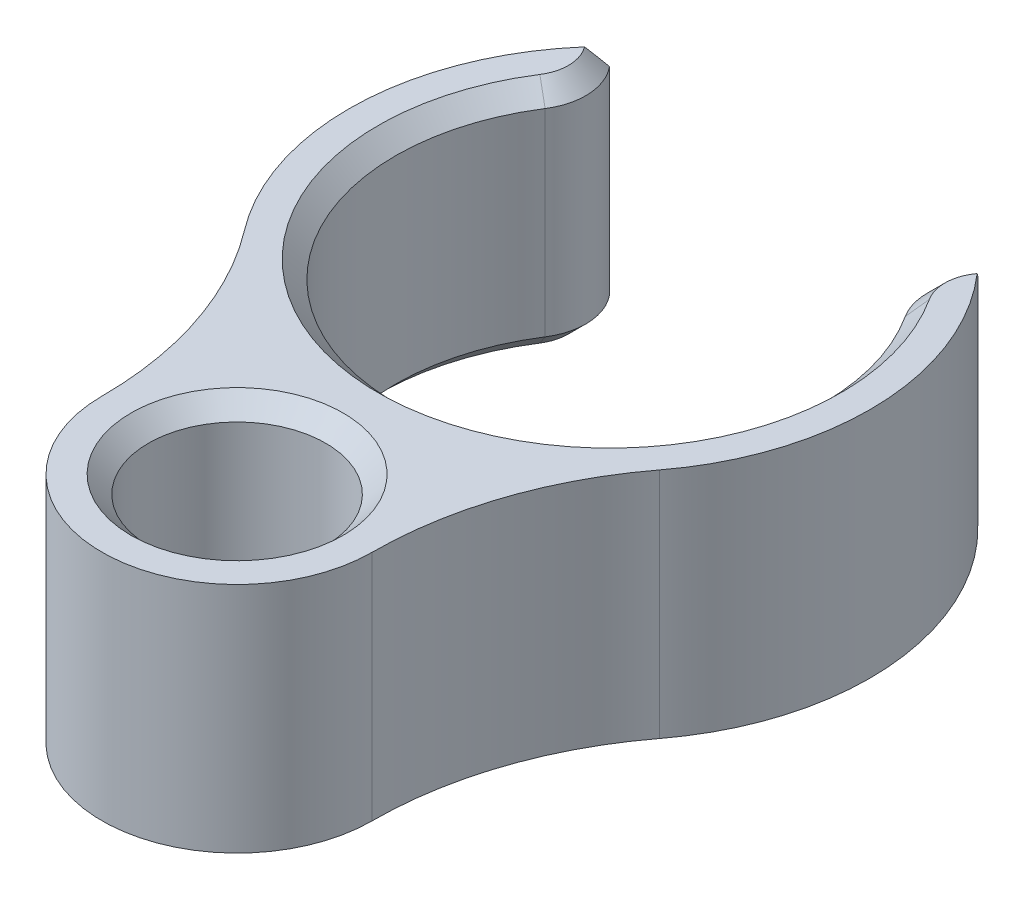
from build123d import *

# Parameters (mm, degrees)
SKETCH1_R           = 3.81
BOSS_EXTRUDE1_DEPTH = 10
CHAMFER1_SIZE       = 0.75
FILLET1_R           = 2.5
CHAMFER2_SIZE       = 0.75


with BuildPart() as part:
    # Sketch1 → Boss-Extrude1 (new body)
    # profile 1 of 2: a face of its own
    with BuildSketch(Plane(origin=(0, 0, 0), x_dir=(1, 0, 0), z_dir=(0, 1, 0))):
        with BuildLine():
            Line((-6.505382387, 22.515382387), (-7.919595949, 23.929595949))
            ThreePointArc((-7.919595949, 23.929595949), (0, 4.81), (7.919595949, 23.929595949))
            Line((7.919595949, 23.929595949), (6.505382387, 22.515382387))
            ThreePointArc((6.505382387, 22.515382387), (0, 6.81), (-6.505382387, 22.515382387))
        make_face()
    # profile 2 of 2: a face of its own
    with BuildSketch(Plane(origin=(0, 0, 0), x_dir=(1, 0, 0), z_dir=(0, 1, 0))):
        with BuildLine():
            ThreePointArc((8.919585019, 9.236448267), (0, 4.81), (-8.919585019, 9.236448267))
            ThreePointArc((-8.919585019, 9.236448267), (-6.608257967, 4.872922521), (-5.81, 0))
            ThreePointArc((-5.81, 0), (0, -5.81), (5.81, 0))
            ThreePointArc((5.81, 0), (6.608257967, 4.872922521), (8.919585019, 9.236448267))
        make_face()
        with Locations(Location((0, 0, 0), (0, 0, 270))):
            Circle(SKETCH1_R, mode=Mode.SUBTRACT)
    extrude(amount=BOSS_EXTRUDE1_DEPTH)

    # Chamfer1
    chamfer1_edges = [part.edges().sort_by_distance(p)[0] for p in [
        (0, 0, -3.81),
        (0, 10, -3.81),
    ]]
    chamfer(chamfer1_edges, length=CHAMFER1_SIZE)

    # Fillet1
    # the kernel refuses this fillet: 2.5 mm, written as the material it takes off along each edge
    with BuildSketch(Plane(origin=(6.505382387, -5, -22.515382387), x_dir=(0.7071067811865479, 0, -0.707106781186547), z_dir=(0, 1, 0))) as fillet1_piece_1:
        with BuildLine():
            CenterArc((2.232142857, -2.489198605), FILLET1_R, 95.327997904, 72.388325655)
            Line((-0.210622711, -1.957318561), (-0.259478022, -1.94668096))
            ThreePointArc((-0.259478022, -1.94668096), (-0.102520236, -0.978959627), (-0.05, 0))
            Line((-0.05, 0), (0, 0.05))
            ThreePointArc((0, 0.05), (1, 0.05), (1.995357143, 0.049783972))
            Line((1.995357143, 0.049783972), (2, 0))
        make_face()
    extrude(amount=20, mode=Mode.SUBTRACT)
    with BuildSketch(Plane(origin=(-6.505382387, -5, -22.515382387), x_dir=(-0.7071067811865465, 0, -0.7071067811865487), z_dir=(0, 1, 0))) as fillet1_piece_2:
        with BuildLine():
            CenterArc((2.232142857, 2.489198605), FILLET1_R, 192.283676441, 72.388325655)
            Line((-0.210622711, 1.957318561), (-0.259478022, 1.94668096))
            ThreePointArc((-0.259478022, 1.94668096), (-0.102520236, 0.978959627), (-0.05, 0))
            Line((-0.05, 0), (0, -0.05))
            ThreePointArc((0, -0.05), (1, -0.05), (1.995357143, -0.049783972))
            Line((1.995357143, -0.049783972), (2, 0))
        make_face()
    extrude(amount=20, mode=Mode.SUBTRACT)

    # Chamfer2
    chamfer2_edges = [part.edges().sort_by_distance(p)[0] for p in [
        (0, 0, -6.81),
        (0, 10, -6.81),
        (-7.348479111, 0, -22.485272721),
        (7.348479111, 0, -22.485272721),
        (-7.348479111, 10, -22.485272721),
        (7.348479111, 10, -22.485272721),
    ]]
    chamfer(chamfer2_edges, length=CHAMFER2_SIZE)


solid = part.part
